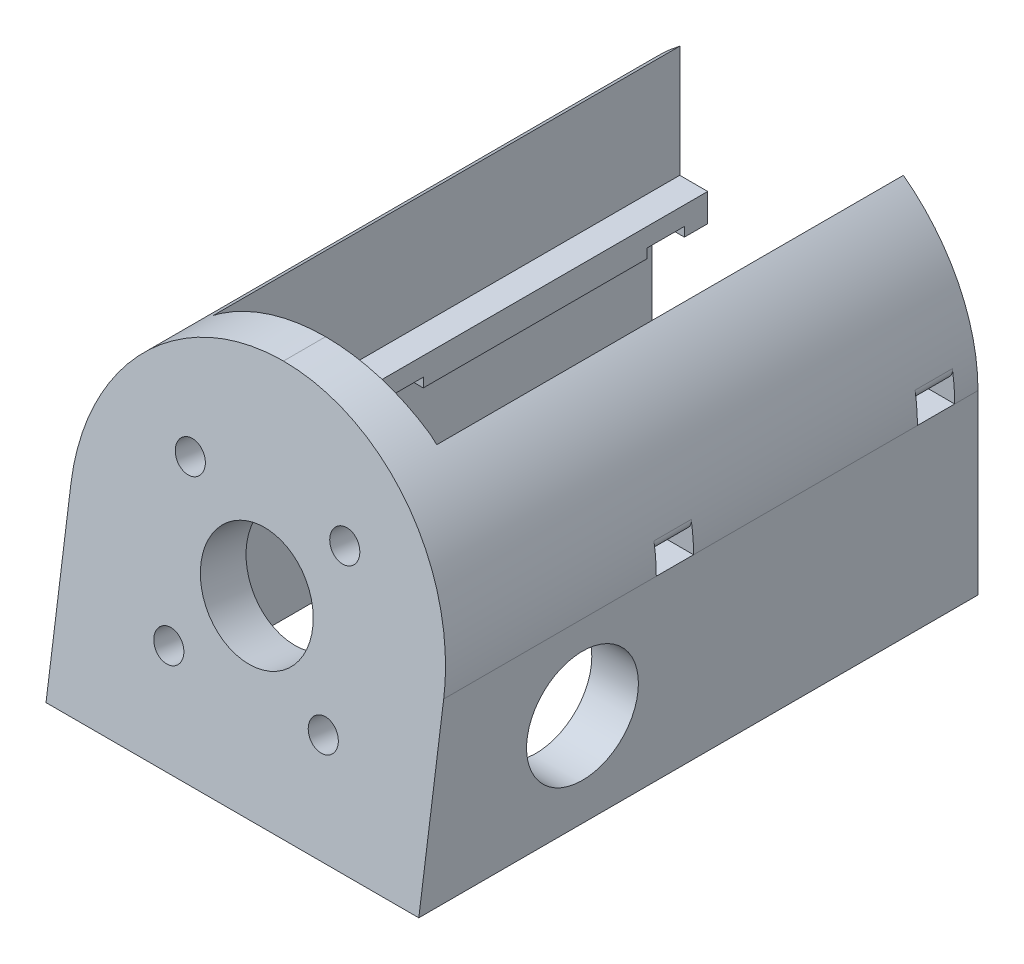
from build123d import *

# Parameters (mm, degrees)
BOSS_EXTRUDE1_DEPTH      = 25.4
BOSS_EXTRUDE1_DEPTH_BACK = 25.4
SKETCH3_R                = 8.382
CUT_EXTRUDE9_DEPTH       = 95.36535858
CUT_EXTRUDE14_DEPTH      = 63.5
SKETCH14_W               = 38.1
SKETCH14_H               = 46.622003784
CUT_EXTRUDE23_DEPTH      = 12.7
CUT_EXTRUDE23_DRAFT      = -8
SKETCH13_W               = 5.08
SKETCH13_H               = 2.54
CUT_EXTRUDE22_DEPTH      = 105.116765701
FILLET4_R                = 25.4
CUT_EXTRUDE24_REACH      = 96.365
SKETCH17_R               = 7.62
SKETCH17_R_2             = 2.032
CUT_EXTRUDE25_DEPTH      = 95.36535858
FILLET5_R                = 1.27
SKETCH17_7_R             = 2.032
CUT_EXTRUDE26_DEPTH      = 12.7
SKETCH18_R               = 7.62
CUT_EXTRUDE27_DEPTH      = 12.7


with BuildPart() as part:
    # Sketch1 → Boss-Extrude1 (new, two sides: drawn at the far end of the back side and taken through both)
    with BuildSketch(Plane(origin=(0, 0, 0), x_dir=(0, 0, -1), z_dir=(1, 0, 0)).offset(-BOSS_EXTRUDE1_DEPTH_BACK)):
        Polygon((0, 0), (6.960987543, 49.53), (76.2, 49.53), (76.2, 0), align=None)
    extrude(amount=BOSS_EXTRUDE1_DEPTH + BOSS_EXTRUDE1_DEPTH_BACK)

    # Sketch3 → Cut-Extrude9 (cut, through all)
    with BuildSketch(Plane.XZ):
        with Locations(Location((0, -63.246, 0), (0, 0, 270))):
            Circle(SKETCH3_R)
        with Locations(Location((0, -25.4, 0), (0, 0, 270))):
            Circle(SKETCH3_R)
    extrude(amount=-CUT_EXTRUDE9_DEPTH, mode=Mode.SUBTRACT)

    # Sketch9 → Cut-Extrude14 (cut)
    with BuildSketch(Plane(origin=(0, 0, -76.2), x_dir=(-1, 0, 0), z_dir=(0, 0, -1))):
        Polygon((-15.24, 49.53), (-15.24, 29.21), (-11.43, 29.21), (-11.43, 25.4), (-19.05, 25.4), (-19.05, 0), (19.05, 0), (19.05, 25.4), (11.43, 25.4), (11.43, 29.21), (15.24, 29.21), (15.24, 49.53), align=None)
    extrude(amount=-CUT_EXTRUDE14_DEPTH, mode=Mode.SUBTRACT)


with BuildPart() as cut_extrude23_tool:
    # Sketch14 → Cut-Extrude23 (with draft: the straight prism first)
    with BuildSketch(Plane.XZ):
        with Locations((0, -29.661001892)):
            Rectangle(SKETCH14_W, SKETCH14_H)
    extrude(amount=-CUT_EXTRUDE23_DEPTH)
    # Cut-Extrude23: the draft: its side faces are tilted about the plane it starts from
    cut_extrude23_sides = [cut_extrude23_tool.faces().sort_by_distance(p)[0] for p in [
        (0, 6.35, -6.35),
        (-19.05, 6.35, -29.661001892),
        (0, 6.35, -52.972003784),
        (19.05, 6.35, -29.661001892),
    ]]
    draft(cut_extrude23_sides, Plane.XZ, CUT_EXTRUDE23_DRAFT)


with BuildPart() as part_1:
    add(part.part)

    # Cut-Extrude23: cut by cut_extrude23_tool
    add(cut_extrude23_tool.part, mode=Mode.SUBTRACT)

    # Sketch13 → Cut-Extrude22 (cut, through all)
    with BuildSketch(Plane.ZY.offset(25.4)):
        with Locations((-70.485, 25.4)):
            Rectangle(SKETCH13_W, SKETCH13_H)
        with Locations((-34.900987543, 25.4)):
            Rectangle(SKETCH13_W, SKETCH13_H)
    extrude(amount=-CUT_EXTRUDE22_DEPTH, mode=Mode.SUBTRACT)

    # Fillet4
    # the kernel refuses this fillet: 25.4 mm, written as the material it takes off along each edge
    with BuildSketch(Plane(origin=(-25.4, 49.53, 56.539012457), x_dir=(1, 0, 0), z_dir=(0, 0, -1)), Plane(origin=(25.4, 49.53, 56.539012457), x_dir=(0, -1, 0), z_dir=(0, 0, -1))) as fillet4_piece_1:
        with BuildLine():
            CenterArc((FILLET4_R, FILLET4_R), FILLET4_R, 180, 90)
            Line((0, FILLET4_R), (0, 0))
            Line((0, 0), (FILLET4_R, 0))
        make_face()
    extrude(amount=196.239012457, mode=Mode.SUBTRACT)

    # Cut-Extrude24: up to this face of the body (flat: up to its plane)
    cut_extrude24_end = Plane(part_1.part.faces().sort_by_distance((0, 6.245967005, -7.227813416))[0])
    # Sketch9<4> → Cut-Extrude24 (cut, up to the picked face)
    with BuildSketch(Plane(origin=(0, 0, -76.2), x_dir=(-1, 0, 0), z_dir=(0, 0, -1)), mode=Mode.PRIVATE) as cut_extrude24_sk1:
        Polygon((-15.24, 49.53), (-15.24, 29.21), (-11.43, 29.21), (-11.43, 25.4), (-19.05, 25.4), (-19.05, 0), (19.05, 0), (19.05, 25.4), (11.43, 25.4), (11.43, 29.21), (15.24, 29.21), (15.24, 49.53), align=None)
    cut_extrude24_tool1 = split(extrude(cut_extrude24_sk1.sketch, amount=-CUT_EXTRUDE24_REACH, mode=Mode.PRIVATE), bisect_by=cut_extrude24_end, keep=Keep.BOTH, mode=Mode.PRIVATE)
    add(cut_extrude24_tool1.solids().sort_by(Axis((0, 23.326156, -76.2), (0, 0, 1)))[0], mode=Mode.SUBTRACT)

    # Sketch17 → Cut-Extrude25 (cut, through all)
    with BuildSketch(Plane(origin=(0, 0, 0), x_dir=(1, 0, 0), z_dir=(0, 0.13917310096006918, 0.9902680687415698))):
        with Locations(Location((0, 23.876, 0), (0, 0, 270))):
            Circle(SKETCH17_R)
        with Locations(Location((10.524860174, 13.351139826, 0), (0, 0, 270))):
            Circle(SKETCH17_R_2)
        with Locations(Location((-10.524860174, 13.351139826, 0), (0, 0, 270))):
            Circle(SKETCH17_R_2)
    extrude(amount=-CUT_EXTRUDE25_DEPTH, mode=Mode.SUBTRACT)

    # Fillet5
    fillet5_edges = [part_1.edges().sort_by_distance(p)[0] for p in [
        (25.272680903, 26.67, -70.485),
        (-25.272680903, 26.67, -70.485),
        (25.272680903, 26.67, -34.900987543),
        (-25.272680903, 26.67, -34.900987543),
    ]]
    fillet(fillet5_edges, radius=FILLET5_R)

    # Sketch17<7> → Cut-Extrude26 (cut)
    with BuildSketch(Plane(origin=(0, 0, 0), x_dir=(1, 0, 0), z_dir=(0, 0.13917310096006918, 0.9902680687415698))):
        with Locations(Location((10.524860174, 34.400860174, 0), (0, 0, 270))):
            Circle(SKETCH17_7_R)
        with Locations(Location((-10.524860174, 34.400860174, 0), (0, 0, 270))):
            Circle(SKETCH17_7_R)
    extrude(amount=-CUT_EXTRUDE26_DEPTH, mode=Mode.SUBTRACT)

    # Sketch18 → Cut-Extrude27 (cut)
    with BuildSketch(Plane(origin=(25.4, 0, 0), x_dir=(0, 0, -1), z_dir=(1, 0, 0))):
        with Locations((22.304564874, 12.7)):
            Circle(SKETCH18_R)
    extrude(amount=-CUT_EXTRUDE27_DEPTH, mode=Mode.SUBTRACT)


solid = part_1.part
